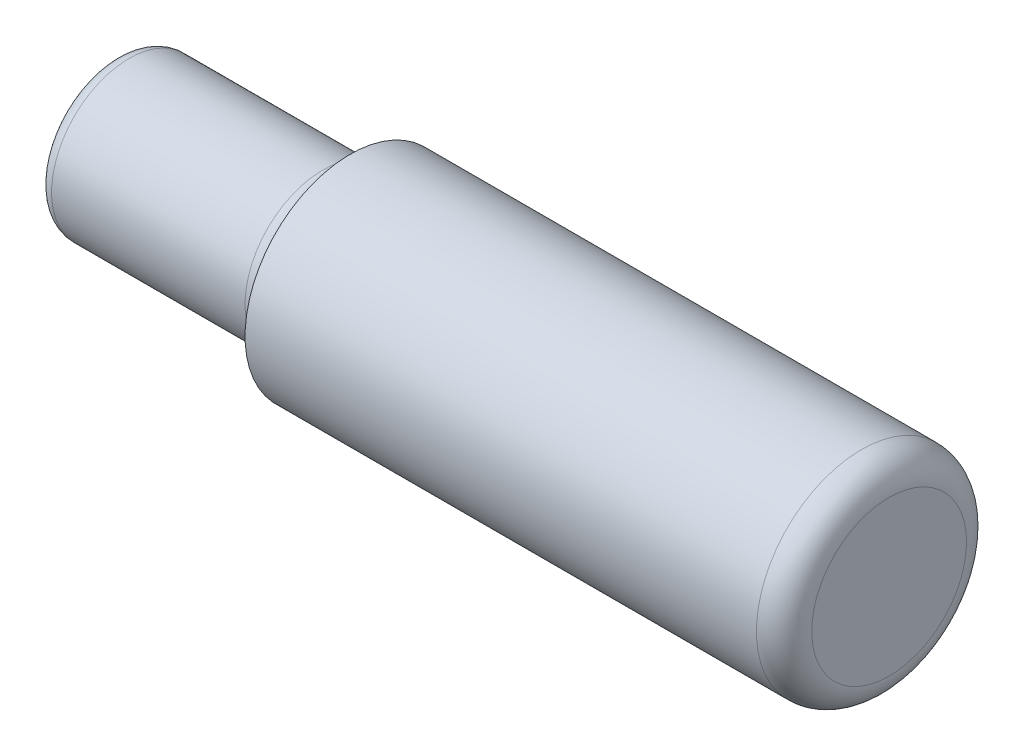
from build123d import *

# Parameters (mm, degrees)
CROQUIS1_R              = 3.8
CROQUIS1_R_2            = 2.8
SALIENTE_EXTRUIR1_DEPTH = 19.5
CROQUIS1_4_R            = 2.8
SALIENTE_EXTRUIR2_DEPTH = 8.5
REDONDEO1_R             = 1
REDONDEO2_R             = 0.5


with BuildPart() as part:
    # Croquis1 → Saliente-Extruir1 (new body)
    # profile 1 of 2: a face of its own
    with BuildSketch(Plane.YZ):
        with Locations(Location((0, 0, 0), (0, 0, 270))):
            Circle(CROQUIS1_R)
        Circle(CROQUIS1_R_2, mode=Mode.SUBTRACT)
    # profile 2 of 2: a face of its own
    with BuildSketch(Plane.YZ):
        Circle(CROQUIS1_R_2)
    extrude(amount=SALIENTE_EXTRUIR1_DEPTH)

    # Croquis1<4> → Saliente-Extruir2 (add)
    with BuildSketch(Plane.YZ):
        with Locations(Location((0, 0, 0), (0, 0, 270))):
            Circle(CROQUIS1_4_R)
    extrude(amount=-SALIENTE_EXTRUIR2_DEPTH)

    # Redondeo1
    redondeo1_edges = [part.edges().sort_by_distance(p)[0] for p in [
        (19.5, 0, 3.8),
        (0, 0, 2.8),
    ]]
    fillet(redondeo1_edges, radius=REDONDEO1_R - 0.0001)  # a hair under: the kernel refuses the full size

    # Redondeo2
    redondeo2_edges = [part.edges().sort_by_distance(p)[0] for p in [
        (-8.5, 0, 2.8),
    ]]
    fillet(redondeo2_edges, radius=REDONDEO2_R)


solid = part.part
